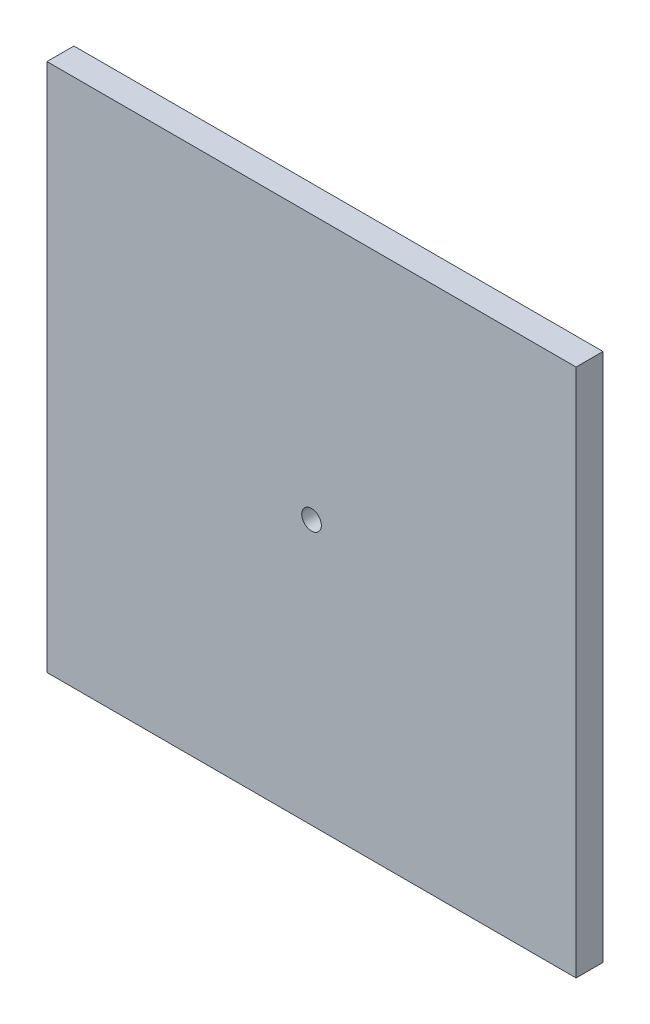
from build123d import *

# Parameters (mm, degrees)
SKETCH1_W           = 171.45
SKETCH1_H           = 171.45
SKETCH1_R           = 3.175
BOSS_EXTRUDE1_DEPTH = 8.73125
SKETCH1_5_R         = 3.175
BOSS_EXTRUDE4_DEPTH = 9.398


with BuildPart() as part:
    # Sketch1 → Boss-Extrude1 (new body)
    with BuildSketch(Plane.XY):
        Rectangle(SKETCH1_W, SKETCH1_H)
        Circle(SKETCH1_R, mode=Mode.SUBTRACT)
    extrude(amount=BOSS_EXTRUDE1_DEPTH)

    # Sketch1<5> → Boss-Extrude4 (add)
    with BuildSketch(Plane.XY):
        with Locations((-73.025, 73.025)):
            Circle(SKETCH1_5_R)
        with Locations((73.025, 73.025)):
            Circle(SKETCH1_5_R)
        with Locations((73.025, -73.025)):
            Circle(SKETCH1_5_R)
        with Locations((-73.025, -73.025)):
            Circle(SKETCH1_5_R)
    extrude(amount=-BOSS_EXTRUDE4_DEPTH)


solid = part.part
